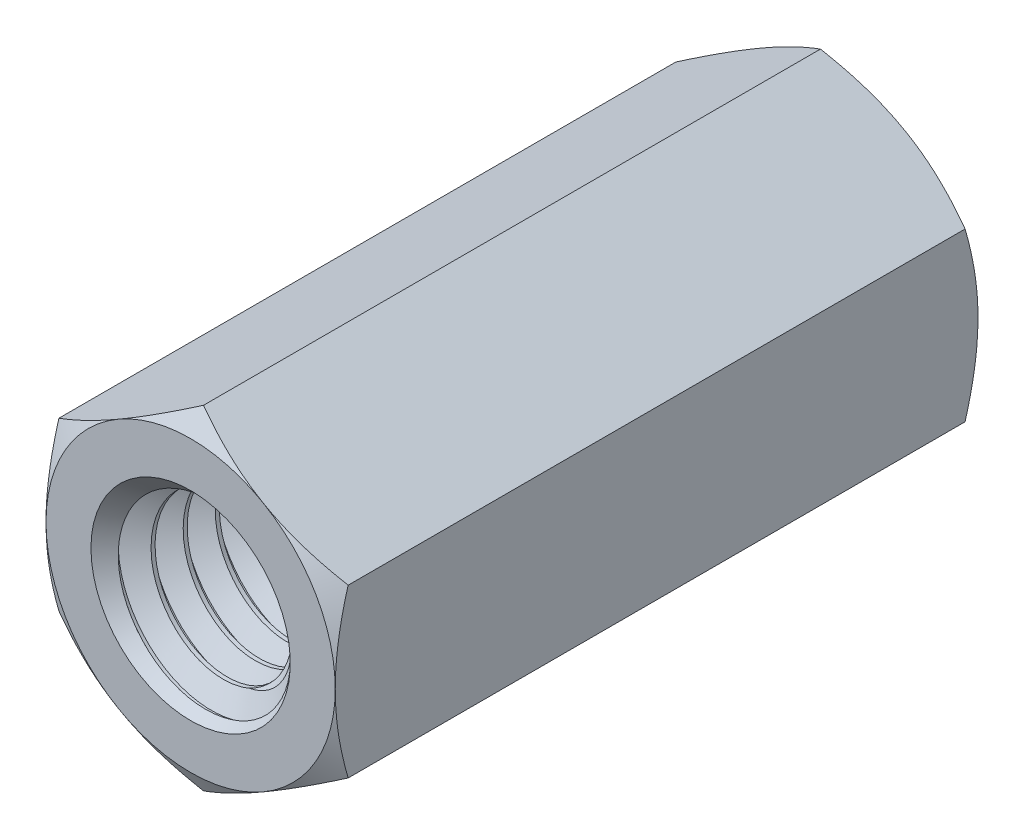
from build123d import *

# Parameters (mm, degrees)
EXTRUDE1_DEPTH          = 5
EXTRUDE1_DEPTH_BACK     = 5
SKETCH1_R               = 1.5
SWEEP1_PITCH            = 0.5
EXTRUDE2_DEPTH          = 12.048354647
SKETCH8_OUTSIDE_W       = 50.746
SKETCH8_OUTSIDE_H       = 51.442
SKETCH8_OUTSIDE_R       = 2.25
EXTRUDE4_DEPTH          = 12.048354647
EXTRUDE4_DRAFT          = -60
MIRROR1_COPY_1_SKETCH_W = 50.746
MIRROR1_COPY_1_SKETCH_H = 51.442
MIRROR1_COPY_1_SKETCH_R = 2.25
MIRROR1_COPY_1_DEPTH    = 12.048354647
MIRROR1_COPY_1_DRAFT    = -60


with BuildPart() as part:
    # Sketch1 → Extrude1 (new, two sides: drawn at the far end of the back side and taken through both)
    with BuildSketch(Plane.XY.offset(-EXTRUDE1_DEPTH_BACK)):
        Polygon((0, 2.598076211), (-2.25, 1.299038106), (-2.25, -1.299038106), (0, -2.598076211), (2.25, -1.299038106), (2.25, 1.299038106), align=None)
        Circle(SKETCH1_R, mode=Mode.SUBTRACT)
    extrude(amount=EXTRUDE1_DEPTH + EXTRUDE1_DEPTH_BACK)

    # Sweep1: the profile of Sketch12 profile screwed along a right-hand helix of 21 turns, 6 arcs to a turn; built about Z, then put on its axis
    sweep1_z = Axis((0, 0, 0), (0, 0, 1))
    sweep1_corners = [(1.5003, 0, -0.437673205), (1.5003, 0, 0.000173205), (1.175240474, 0, -0.1875), (1.175240474, 0, -0.25)]
    with BuildLine(mode=Mode.PRIVATE) as sweep1_profile:
        Line(sweep1_corners[0], sweep1_corners[1])
        Line(sweep1_corners[1], sweep1_corners[2])
        Line(sweep1_corners[2], sweep1_corners[3])
        Line(sweep1_corners[3], sweep1_corners[0])
    sweep1_cap = Face(sweep1_profile.wire())
    sweep1_turn_angles = [0, 30, 60, 90, 120, 150, 180, 210, 240, 270, 300, 330, 360]
    sweep1_turn_weights = [1, 0.8660254037844387, 1, 0.8660254037844387, 1, 0.8660254037844387, 1, 0.8660254037844387, 1, 0.8660254037844387, 1, 0.8660254037844387, 1]
    sweep1_turn_rails = [Edge.make_bspline([Vector(p[0], p[1], 0).rotate(sweep1_z, sweep1_turn_angles[k]) / sweep1_turn_weights[k] + Vector(0, 0, p[2] + SWEEP1_PITCH * sweep1_turn_angles[k] / 360) for k in range(13)], [0, 0, 0, 1, 1, 2, 2, 3, 3, 4, 4, 5, 5, 6, 6, 6], 2, sweep1_turn_weights) for p in sweep1_corners]
    sweep1_turn_sides = [Face.make_surface_from_curves(sweep1_turn_rails[p[0]], sweep1_turn_rails[p[1]]) for p in [(0, 1), (1, 2), (2, 3), (3, 0)]]
    sweep1 = Plane(origin=(0, 0, -5), x_dir=(0, 1, 0), z_dir=(0, 0, 1)) * Solid(Shell([*[p.moved(Location((0, 0, SWEEP1_PITCH * i))) for i in range(21) for p in sweep1_turn_sides], sweep1_cap, sweep1_cap.rotate(sweep1_z, 7560).moved(Location((0, 0, SWEEP1_PITCH * 7560 / 360)))]))
    add(sweep1)

    # Sketch6 → Extrude2 (cut, through all)
    with BuildSketch(Plane(origin=(0, 0, -5), x_dir=(-1, 0, 0), z_dir=(0, 0, -1))):
        Polygon((0, 2.598076211), (-2.25, 1.299038106), (-2.25, -1.299038106), (0, -2.598076211), (2.25, -1.299038106), (2.25, 1.299038106), align=None)
    extrude2 = extrude(amount=EXTRUDE2_DEPTH, mode=Mode.SUBTRACT)

    # Extrude3 cone 1 section (through the dimple's axis) → Extrude3 (revolve, cut)
    with BuildSketch(Plane(origin=(0, 0, -5), x_dir=(0, 1, 0), z_dir=(1, 0, 0))):
        Polygon((0, 0), (1.5508, 0), (0, 1.663029396), align=None)
    extrude3 = revolve(axis=Axis((0, 0, -5), (0, 0, 1)), mode=Mode.SUBTRACT)


with BuildPart() as extrude4_tool:
    # Sketch8 outside → Extrude4 (with draft: the straight prism first)
    with BuildSketch(Plane(origin=(0, 0, -5), x_dir=(-1, 0, 0), z_dir=(0, 0, -1))):
        Rectangle(SKETCH8_OUTSIDE_W, SKETCH8_OUTSIDE_H)
        Circle(SKETCH8_OUTSIDE_R, mode=Mode.SUBTRACT)
    extrude(amount=-EXTRUDE4_DEPTH)
    # Extrude4: the draft: its side faces are tilted about the plane it starts from
    extrude4_sides = [extrude4_tool.faces().sort_by_distance(p)[0] for p in [
        (0, -25.721, 1.024177323),
        (-25.373, 0, 1.024177323),
        (0, 25.721, 1.024177323),
        (25.373, 0, 1.024177323),
        (2.25, 0, 1.024177323),
    ]]
    draft(extrude4_sides, Plane(origin=(0, 0, -5), x_dir=(-1, 0, 0), z_dir=(0, 0, -1)), EXTRUDE4_DRAFT)


with BuildPart() as part_1:
    add(part.part)

    # Extrude4: cut by extrude4_tool
    add(extrude4_tool.part, mode=Mode.SUBTRACT)

    # Mirror1: Extrude2, Extrude3 across plane
    add(extrude2.mirror(Plane.XY), mode=Mode.SUBTRACT)
    add(extrude3.mirror(Plane.XY), mode=Mode.SUBTRACT)


with BuildPart() as mirror1_copy_1_tool:
    # Mirror1 copy 1 sketch → Mirror1 copy 1 (with draft: the straight prism first)
    with BuildSketch(Plane(origin=(0, 0, 5), x_dir=(-1, 0, 0), z_dir=(0, 0, 1))):
        Rectangle(MIRROR1_COPY_1_SKETCH_W, MIRROR1_COPY_1_SKETCH_H)
        Circle(MIRROR1_COPY_1_SKETCH_R, mode=Mode.SUBTRACT)
    extrude(amount=-MIRROR1_COPY_1_DEPTH)
    # Mirror1 copy 1: the draft: its side faces are tilted about the plane it starts from
    mirror1_copy_1_sides = [mirror1_copy_1_tool.faces().sort_by_distance(p)[0] for p in [
        (0, -25.721, -1.024177323),
        (-25.373, 0, -1.024177323),
        (0, 25.721, -1.024177323),
        (25.373, 0, -1.024177323),
        (2.25, 0, -1.024177323),
    ]]
    draft(mirror1_copy_1_sides, Plane(origin=(0, 0, 5), x_dir=(-1, 0, 0), z_dir=(0, 0, 1)), MIRROR1_COPY_1_DRAFT)


with BuildPart() as part_2:
    add(part_1.part)

    # Mirror1 copy 1: cut by mirror1_copy_1_tool
    add(mirror1_copy_1_tool.part, mode=Mode.SUBTRACT)


solid = part_2.part
